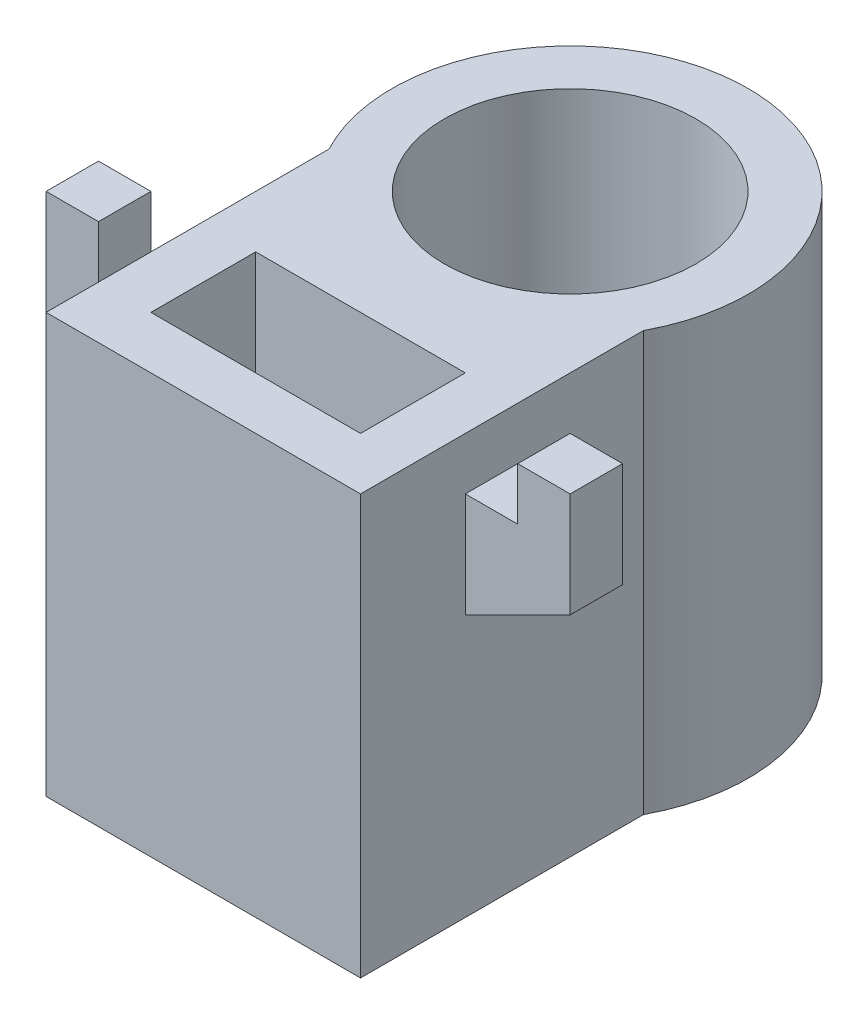
from build123d import *

# Parameters (mm, degrees)
SKETCH1_R           = 7.62
SKETCH1_W           = 12.7
SKETCH1_H           = 6.35
BOSS_EXTRUDE1_DEPTH = 25.4
BOSS_EXTRUDE2_DEPTH = 3.175


with BuildPart() as part:
    # Sketch1 → Boss-Extrude1 (new body)
    with BuildSketch(Plane(origin=(0, 0, 0), x_dir=(1, 0, 0), z_dir=(0, 1, 0))):
        with BuildLine():
            Line((-9.525, -22.225), (9.525, -22.225))
            Line((9.525, -22.225), (9.525, -5.08))
            ThreePointArc((9.525, -5.08), (0, 10.795), (-9.525, -5.08))
            Line((-9.525, -5.08), (-9.525, -22.225))
        make_face()
        Circle(SKETCH1_R, mode=Mode.SUBTRACT)
        with Locations((0, -15.875)):
            Rectangle(SKETCH1_W, SKETCH1_H, mode=Mode.SUBTRACT)
    extrude(amount=BOSS_EXTRUDE1_DEPTH)

    # Sketch3 → Boss-Extrude2 (add)
    with BuildSketch(Plane(origin=(0, 0, 15.875), x_dir=(-1, 0, 0), z_dir=(0, 0, -1))):
        Polygon((-9.525, 22.225), (-9.525, 15.875), (-15.875, 19.05), (-15.875, 25.4), (-12.7, 25.4), (-12.7, 22.225), align=None)
    boss_extrude2 = extrude(amount=BOSS_EXTRUDE2_DEPTH)

    # Mirror1: Boss-Extrude2 across plane
    add(boss_extrude2.mirror(Plane(origin=(0, 0, 0), x_dir=(0, 0, 1), z_dir=(1, 0, 0))))


solid = part.part
